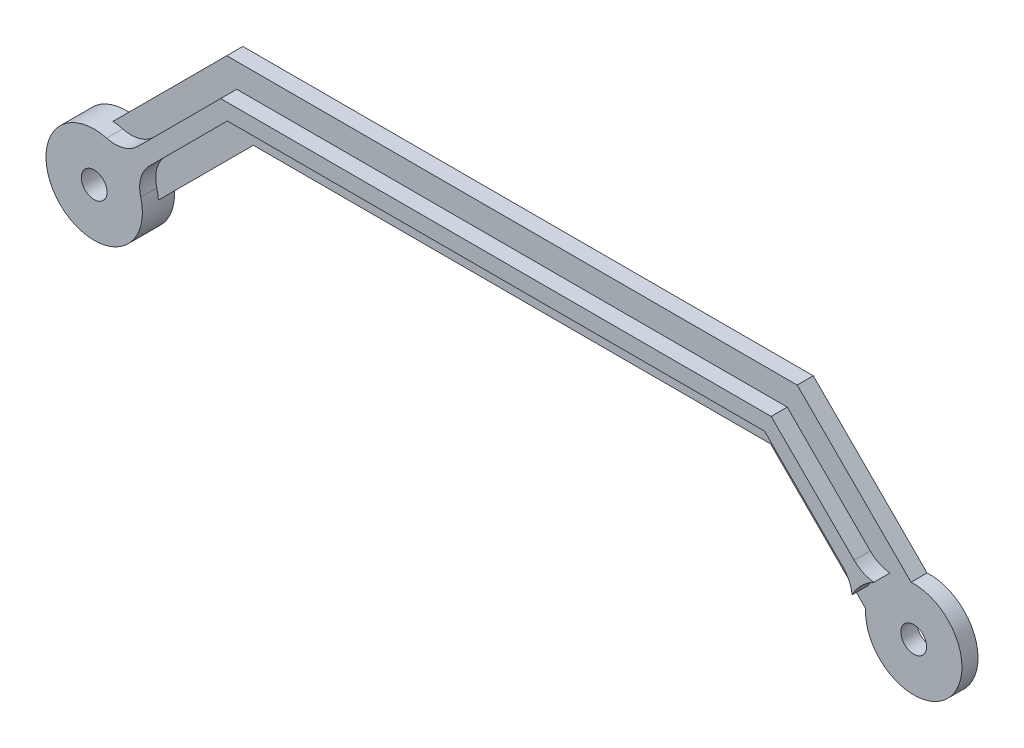
from build123d import *

# Parameters (mm, degrees)
SKETCH1_R             = 4
BOSS_EXTRUDE1_DEPTH   = 5
BOSS_EXTRUDE2_DEPTH   = 5
SKETCH7_R             = 15
SKETCH7_R_2           = 4
BOSS_EXTRUDE3_DEPTH   = 5
FILLET1_R             = 10
IZIM1_R               = 16
KES_EKSTR_ZYON1_DEPTH = 5


with BuildPart() as part:
    # Sketch1 → Boss-Extrude1 (new body)
    with BuildSketch(Plane.XY):
        with BuildLine():
            Line((44.539250231, 30.397114607), (14.976761962, 0.834626339))
            ThreePointArc((14.976761962, 0.834626339), (-10.606601718, -10.606601718), (0.834626339, 14.976761962))
            Line((0.834626339, 14.976761962), (36.254978983, 50.397114607))
            Line((36.254978983, 50.397114607), (213.745021017, 50.397114607))
            Line((213.745021017, 50.397114607), (249.165373661, 14.976761962))
            ThreePointArc((249.165373661, 14.976761962), (260.606601718, -10.606601718), (235.023238038, 0.834626339))
            Line((235.023238038, 0.834626339), (205.460749769, 30.397114607))
            Line((205.460749769, 30.397114607), (44.539250231, 30.397114607))
        make_face()
        Circle(SKETCH1_R, mode=Mode.SUBTRACT)
        with Locations((250, 0)):
            Circle(SKETCH1_R, mode=Mode.SUBTRACT)
    extrude(amount=BOSS_EXTRUDE1_DEPTH)

    # Sketch6 → Boss-Extrude2 (add)
    with BuildSketch(Plane.XY.offset(5)):
        Polygon((243.862072803, 9.673461103), (210.638419299, 42.897114607), (39.361580701, 42.897114607), (6.137927197, 9.673461103), (9.673461103, 6.137927197), (41.432648513, 37.897114607), (208.567351487, 37.897114607), (240.326538897, 6.137927197), align=None)
    extrude(amount=BOSS_EXTRUDE2_DEPTH)

    # Sketch7 → Boss-Extrude3 (add)
    # profile 1 of 2: a face of its own
    with BuildSketch(Plane.XY.offset(5)):
        Circle(SKETCH7_R)
        Circle(SKETCH7_R_2, mode=Mode.SUBTRACT)
    # profile 2 of 2: a face of its own
    with BuildSketch(Plane.XY.offset(5)):
        with Locations((250, 0)):
            Circle(SKETCH7_R)
        with Locations((250, 0)):
            Circle(SKETCH7_R_2, mode=Mode.SUBTRACT)
    extrude(amount=BOSS_EXTRUDE3_DEPTH)

    # Fillet1
    fillet1_edges = [part.edges().sort_by_distance(p)[0] for p in [
        (237.773982715, 8.690483379, 7.5),
        (241.309516621, 12.226017285, 7.5),
        (8.690483379, 12.226017285, 7.5),
        (12.226017285, 8.690483379, 7.5),
    ]]
    fillet(fillet1_edges, radius=FILLET1_R)

    # Çizim1 → Kes-Ekstrüzyon1 (cut)
    with BuildSketch(Plane.XY.offset(10)):
        with Locations((250, 0)):
            Circle(IZIM1_R)
    extrude(amount=-KES_EKSTR_ZYON1_DEPTH, mode=Mode.SUBTRACT)


solid = part.part
